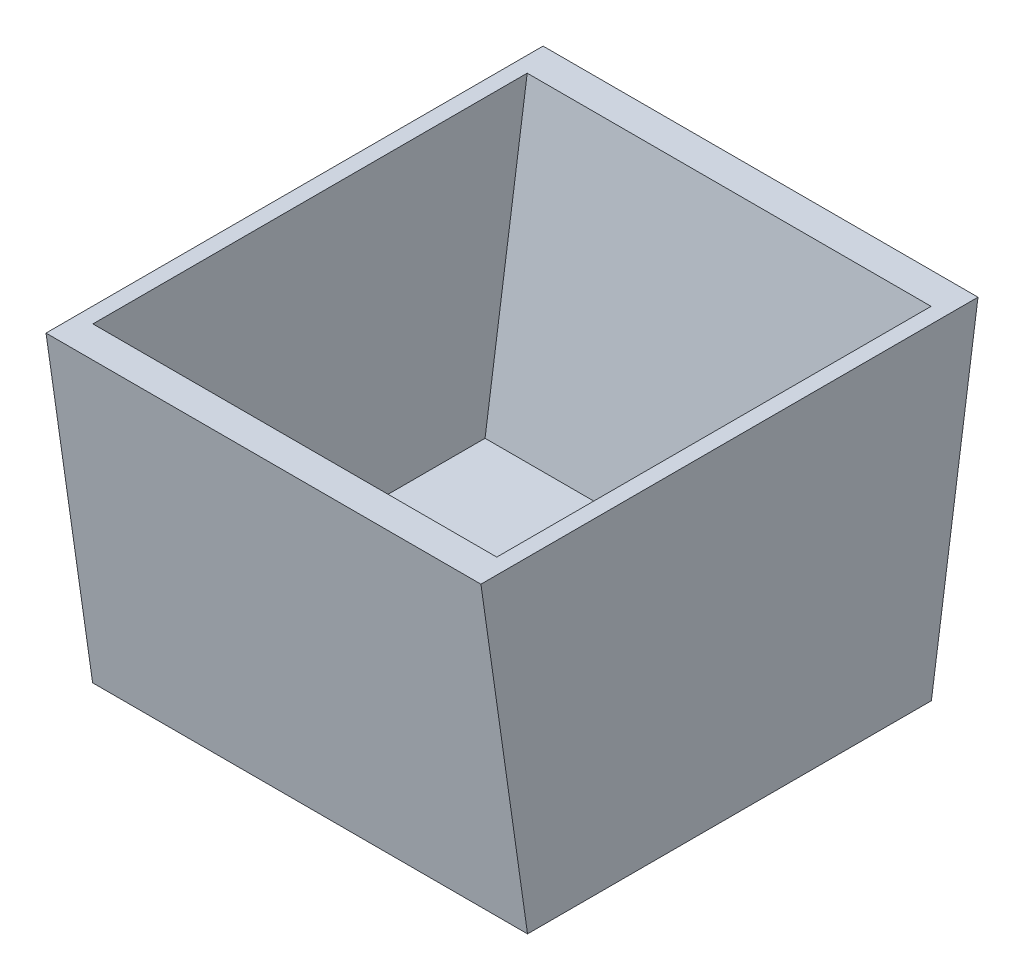
from build123d import *

# Parameters (mm, degrees)
SHELL1_T                 = -25.4
SHELL1_THICKNESS_2_DEPTH = 12.7
SHELL1_THICKNESS_3_DEPTH = 12.7


with BuildPart() as part:
    # Sketch1 → Loft1 section 0
    with BuildSketch(Plane(origin=(0, 0, 0), x_dir=(1, 0, 0), z_dir=(0, 1, 0))):
        with BuildLine():
            Line((-177.8, 165.1), (177.8, 165.1))
            Line((177.8, 165.1), (177.8, -165.1))
            Line((177.8, -165.1), (-177.8, -165.1))
            Line((-177.8, -165.1), (-177.8, 165.1))
        make_face()
    # Sketch2 → Loft1 section 1
    with BuildSketch(Plane(origin=(0, 266.7, 0), x_dir=(1, 0, 0), z_dir=(0, 1, 0))):
        with BuildLine():
            Line((-177.8, 203.2), (177.8, 203.2))
            Line((177.8, 203.2), (177.8, -203.2))
            Line((177.8, -203.2), (-177.8, -203.2))
            Line((-177.8, -203.2), (-177.8, 203.2))
        make_face()
    loft()

    # Shell1
    shell1_openings = [part.faces().sort_by_distance(p)[0] for p in [
        (0, 266.7, 0),
    ]]
    offset(amount=SHELL1_T, openings=shell1_openings, kind=Kind.INTERSECTION)

    # Shell1 thickness 2 face (on inner face of the shell) → Shell1 thickness 2 (cut)
    with BuildSketch(Plane(origin=(-152.4, 150.373987865, 0), x_dir=(0, 0, -1), z_dir=(-1, 0, 0))):
        Polygon((-143.070696797, 124.973987865), (143.070696797, 124.973987865), (177.542125368, -116.326012135), (-177.542125368, -116.326012135), align=None)
    extrude(amount=SHELL1_THICKNESS_2_DEPTH, mode=Mode.SUBTRACT)

    # Shell1 thickness 3 face (on inner face of the shell) → Shell1 thickness 3 (cut)
    with BuildSketch(Plane(origin=(152.4, 150.373987865, 0), x_dir=(0, 0, 1), z_dir=(1, 0, 0))):
        Polygon((177.542125368, -116.326012135), (-177.542125368, -116.326012135), (-143.070696797, 124.973987865), (143.070696797, 124.973987865), align=None)
    extrude(amount=SHELL1_THICKNESS_3_DEPTH, mode=Mode.SUBTRACT)


solid = part.part
